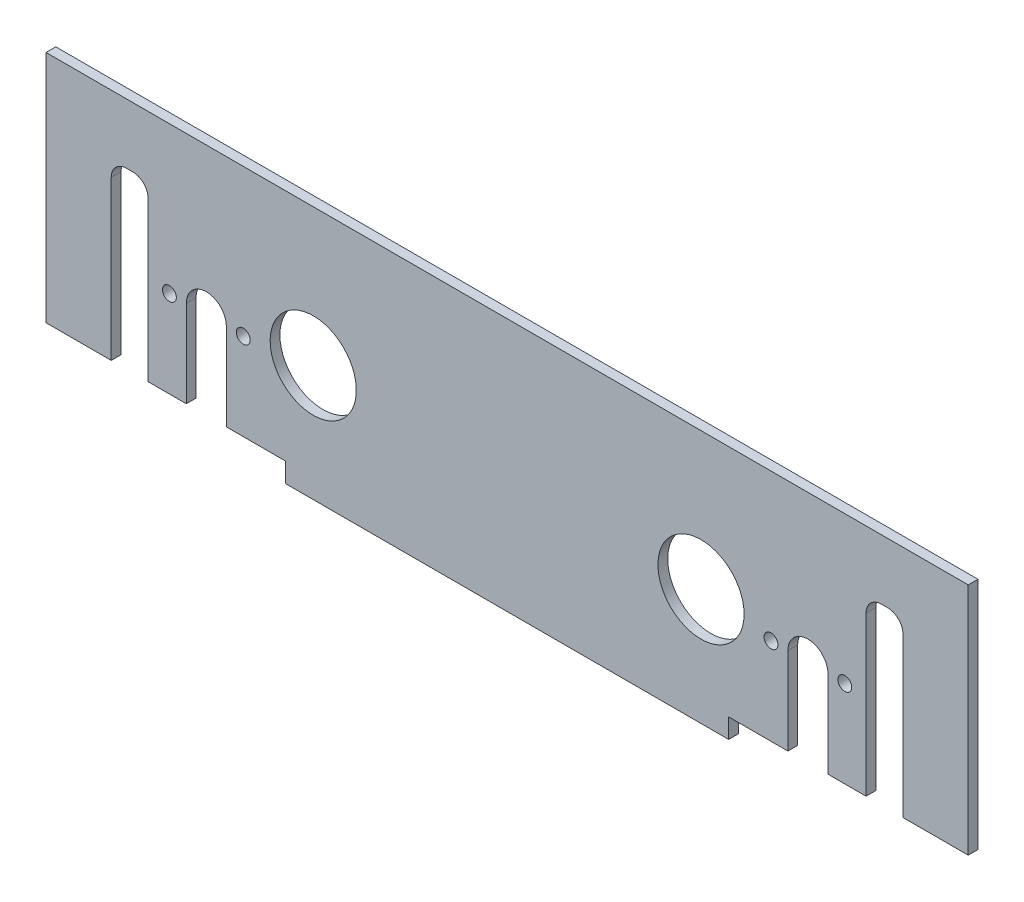
from build123d import *

# Parameters (mm, degrees)
SKETCH1_W            = 299.7
SKETCH1_H            = 76.075
BOSS_EXTRUDE1_DEPTH  = 3.175
CUT_EXTRUDE4_DEPTH   = 155.634907221
CUT_EXTRUDE5_DEPTH   = 155.634907221
M4_CLEARANCE_HOLE1_D = 4.5
SKETCH12_W           = 144
SKETCH12_H           = 3.175
BOSS_EXTRUDE2_DEPTH  = 6.35
SKETCH13_R           = 14
CUT_EXTRUDE6_DEPTH   = 157.318115653


with BuildPart() as part:
    # Sketch1 → Boss-Extrude1 (new body)
    with BuildSketch(Plane.XY):
        Rectangle(SKETCH1_W, SKETCH1_H)
    extrude(amount=BOSS_EXTRUDE1_DEPTH)

    # Sketch8 → Cut-Extrude4 (cut, through all)
    with BuildSketch(Plane.XY.offset(3.175)):
        with BuildLine():
            Line((116.65, 13.5125), (116.65, -38.0375))
            Line((116.65, -38.0375), (128.65, -38.0375))
            Line((128.65, -38.0375), (128.65, 13.5125))
            ThreePointArc((128.65, 13.5125), (127.185533906, 17.048033906), (123.65, 18.5125))
            Line((123.65, 18.5125), (121.65, 18.5125))
            ThreePointArc((121.65, 18.5125), (118.114466094, 17.048033906), (116.65, 13.5125))
        make_face()
    cut_extrude4 = extrude(amount=-CUT_EXTRUDE4_DEPTH, mode=Mode.SUBTRACT)

    # Mirror3: Cut-Extrude4 across plane
    add(cut_extrude4.mirror(Plane(origin=(0, 0, 0), x_dir=(0, 0, 1), z_dir=(1, 0, 0))), mode=Mode.SUBTRACT)

    # Sketch3 → Cut-Extrude5 (cut, through all)
    with BuildSketch(Plane(origin=(0, 0, 0), x_dir=(-1, 0, 0), z_dir=(0, 0, -1))):
        with BuildLine():
            Line((-104.25, -38.0375), (-91.25, -38.0375))
            Line((-91.25, -38.0375), (-91.25, -9.7625))
            ThreePointArc((-91.25, -9.7625), (-97.75, -3.2625), (-104.25, -9.7625))
            Line((-104.25, -9.7625), (-104.25, -38.0375))
        make_face()
        with BuildLine():
            Line((91.25, -38.0375), (104.25, -38.0375))
            Line((104.25, -38.0375), (104.25, -9.7625))
            ThreePointArc((104.25, -9.7625), (97.75, -3.2625), (91.25, -9.7625))
            Line((91.25, -9.7625), (91.25, -38.0375))
        make_face()
    extrude(amount=-CUT_EXTRUDE5_DEPTH, mode=Mode.SUBTRACT)

    # M4 Clearance Hole1 (through all)
    with Locations(Plane(origin=(0, 0, 0), x_dir=(-1, 0, 0), z_dir=(0, 0, -1))):
        with Locations((-85.75, -9.7625), (-109.75, -9.7625), (109.75, -9.7625), (85.75, -9.7625)):
            Hole(M4_CLEARANCE_HOLE1_D / 2)

    # Sketch12 → Boss-Extrude2 (add)
    with BuildSketch(Plane.XZ.offset(38.0375)):
        with Locations((0, 1.5875)):
            Rectangle(SKETCH12_W, SKETCH12_H)
    extrude(amount=BOSS_EXTRUDE2_DEPTH)

    # Sketch13 → Cut-Extrude6 (cut, through all)
    with BuildSketch(Plane(origin=(0, 0, 0), x_dir=(-1, 0, 0), z_dir=(0, 0, -1))):
        with Locations((63.008899223, -6.644651545)):
            Circle(SKETCH13_R)
    cut_extrude6 = extrude(amount=-CUT_EXTRUDE6_DEPTH, mode=Mode.SUBTRACT)

    # Mirror4: Cut-Extrude6 across plane
    add(cut_extrude6.mirror(Plane(origin=(0, 0, 0), x_dir=(0, 0, 1), z_dir=(1, 0, 0))), mode=Mode.SUBTRACT)


solid = part.part
